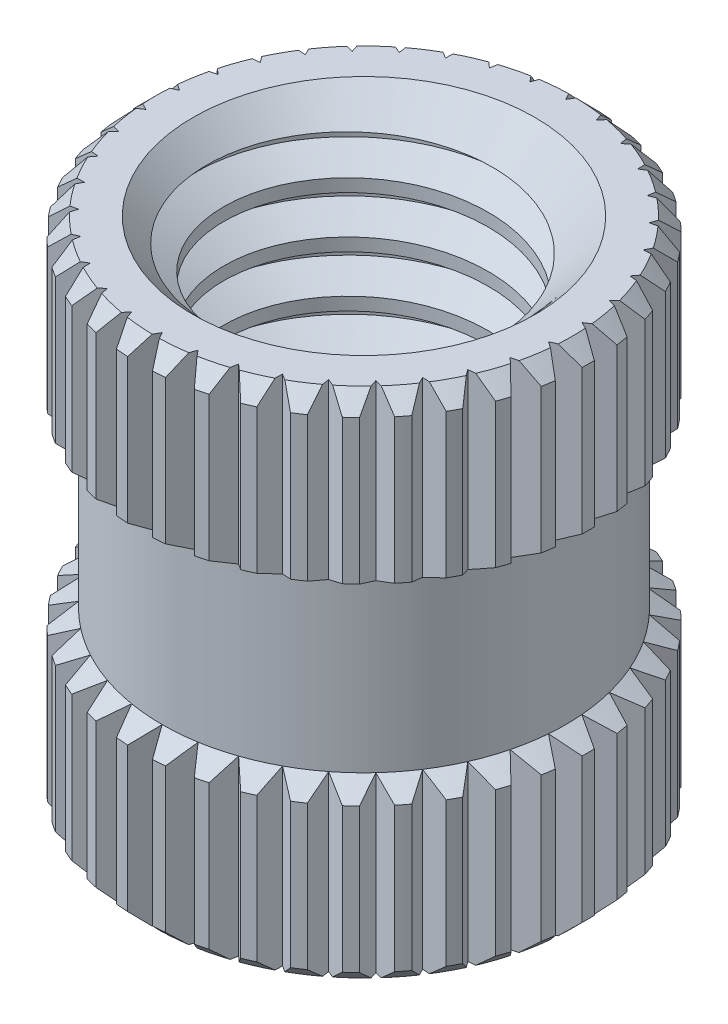
from build123d import *

# Parameters (mm, degrees)
SCHIZZO4_R                  = 2.5
TAGLIO_ESTRUSIONE1_DEPTH    = 10
FILETTATURA1_PITCH          = 0.8
FILETTATURA1_FROM           = 1
FILETTATURA1_TO             = 9
TAGLIO_ESTRUSIONE2_DEPTH    = 10.407443946
RIPETIZIONECIRCOLARE1_COUNT = 38


with BuildPart() as part:
    # Schizzo1 → Rivoluzione1 (revolve)
    with BuildSketch(Plane.XY, mode=Mode.PRIVATE) as rivoluzione1_sk:
        Polygon((0, 0), (0, 8), (-3.25, 8), (-3.5, 7.75), (-3.5, 5.5), (-3.15, 5.297927406), (-3.15, 2.702072594), (-3.5, 2.5), (-3.5, 0.25), (-3.25, 0), align=None)
    revolve(rivoluzione1_sk.sketch.rotate(Axis((0, 0, 0), (0, 1, 0)), 270), axis=Axis((0, 0, 0), (0, 1, 0)))

    # Schizzo4 → Taglio-Estrusione1 (cut)
    with BuildSketch(Plane(origin=(0, 8, 0), x_dir=(1, 0, 0), z_dir=(0, 1, 0))):
        with Locations(Location((0, 0, 0), (0, 0, 270))):
            Circle(SCHIZZO4_R)
    extrude(amount=-TAGLIO_ESTRUSIONE1_DEPTH, mode=Mode.SUBTRACT)

    # Filettatura1: arcs per turn and ends read off the stored shape
    # Filettatura1: the profile of Profilo filettatura2 profile screwed along a right-hand helix through 11.25 turns, 8 arcs to a turn; built about Z, then put on its axis
    filettatura1_z = Axis((0, 0, 0), (0, 0, 1))
    filettatura1_corners = [(2.5003, 0, -0.000173205), (2.5003, 0, 0.700173203), (2.0669873, 0, 0.449999999), (2.0669873, 0, 0.249999999)]
    with BuildLine(mode=Mode.PRIVATE) as filettatura1_profile:
        Line(filettatura1_corners[0], filettatura1_corners[1])
        Line(filettatura1_corners[1], filettatura1_corners[2])
        Line(filettatura1_corners[2], filettatura1_corners[3])
        Line(filettatura1_corners[3], filettatura1_corners[0])
    filettatura1_cap = Face(filettatura1_profile.wire())
    filettatura1_turn_angles = [0, 22.5, 45, 67.5, 90, 112.5, 135, 157.5, 180, 202.5, 225, 247.5, 270, 292.5, 315, 337.5, 360]
    filettatura1_turn_weights = [1, 0.9238795325112867, 1, 0.9238795325112867, 1, 0.9238795325112867, 1, 0.9238795325112867, 1, 0.9238795325112867, 1, 0.9238795325112867, 1, 0.9238795325112867, 1, 0.9238795325112867, 1]
    filettatura1_turn_rails = [Edge.make_bspline([Vector(p[0], p[1], 0).rotate(filettatura1_z, filettatura1_turn_angles[k]) / filettatura1_turn_weights[k] + Vector(0, 0, p[2] + FILETTATURA1_PITCH * filettatura1_turn_angles[k] / 360) for k in range(17)], [0, 0, 0, 1, 1, 2, 2, 3, 3, 4, 4, 5, 5, 6, 6, 7, 7, 8, 8, 8], 2, filettatura1_turn_weights) for p in filettatura1_corners]
    filettatura1_turn_sides = [Face.make_surface_from_curves(filettatura1_turn_rails[p[0]], filettatura1_turn_rails[p[1]]) for p in [(0, 1), (1, 2), (2, 3), (3, 0)]]
    filettatura1_last_angles = [3960, 3982.5, 4005, 4027.5, 4050]
    filettatura1_last_weights = [1, 0.9238795325112867, 1, 0.9238795325112852, 1]
    filettatura1_last_rails = [Edge.make_bspline([Vector(p[0], p[1], 0).rotate(filettatura1_z, filettatura1_last_angles[k]) / filettatura1_last_weights[k] + Vector(0, 0, p[2] + FILETTATURA1_PITCH * filettatura1_last_angles[k] / 360) for k in range(5)], [0, 0, 0, 1, 1, 2, 2, 2], 2, filettatura1_last_weights) for p in filettatura1_corners]
    filettatura1_last_sides = [Face.make_surface_from_curves(filettatura1_last_rails[p[0]], filettatura1_last_rails[p[1]]) for p in [(0, 1), (1, 2), (2, 3), (3, 0)]]
    filettatura1 = Plane(origin=(0, 9, 0), x_dir=(-1, 0, 0), z_dir=(0, -1, 0)) * split(split(Solid(Shell([*[p.moved(Location((0, 0, FILETTATURA1_PITCH * i))) for i in range(11) for p in filettatura1_turn_sides], *filettatura1_last_sides, filettatura1_cap, filettatura1_cap.rotate(filettatura1_z, 4050).moved(Location((0, 0, FILETTATURA1_PITCH * 4050 / 360)))])), bisect_by=Plane.XY.offset(FILETTATURA1_FROM), keep=Keep.TOP, mode=Mode.PRIVATE), bisect_by=Plane.XY.offset(FILETTATURA1_TO), keep=Keep.BOTTOM, mode=Mode.PRIVATE)
    add(filettatura1)

    # Schizzo10 → Taglia-Rivoluzione3 (revolve, cut)
    with BuildSketch(Plane.XY, mode=Mode.PRIVATE) as taglia_rivoluzione3_sk:
        Polygon((-3.6669873, 9), (-1.9669873, 7.3), (-1.9669873, 9), align=None)
        Polygon((-1.9669873, 0.7), (-1.9669873, -1), (-3.6669873, -1), align=None)
    revolve(taglia_rivoluzione3_sk.sketch.rotate(Axis((0, 0, 0), (0, 1, 0)), 292.499999521), axis=Axis((0, 0, 0), (0, 1, 0)), mode=Mode.SUBTRACT)

    # Schizzo12 → Taglio-Estrusione2 (cut, through all)
    with BuildSketch(Plane(origin=(0, 8, 0), x_dir=(1, 0, 0), z_dir=(0, 1, 0))):
        Polygon((0, 3.15), (-0.4, 3.860685827), (0.4, 3.860685827), align=None)
    taglio_estrusione2 = extrude(amount=-TAGLIO_ESTRUSIONE2_DEPTH, mode=Mode.SUBTRACT)

    # RipetizioneCircolare1: Taglio-Estrusione2 ×38 about axis
    ripetizionecircolare1_axis = Axis((0, 0, 0), (0, 1, 0))
    for i in range(1, RIPETIZIONECIRCOLARE1_COUNT):
        add(taglio_estrusione2.rotate(ripetizionecircolare1_axis, i * 360 / RIPETIZIONECIRCOLARE1_COUNT), mode=Mode.SUBTRACT)


solid = part.part
